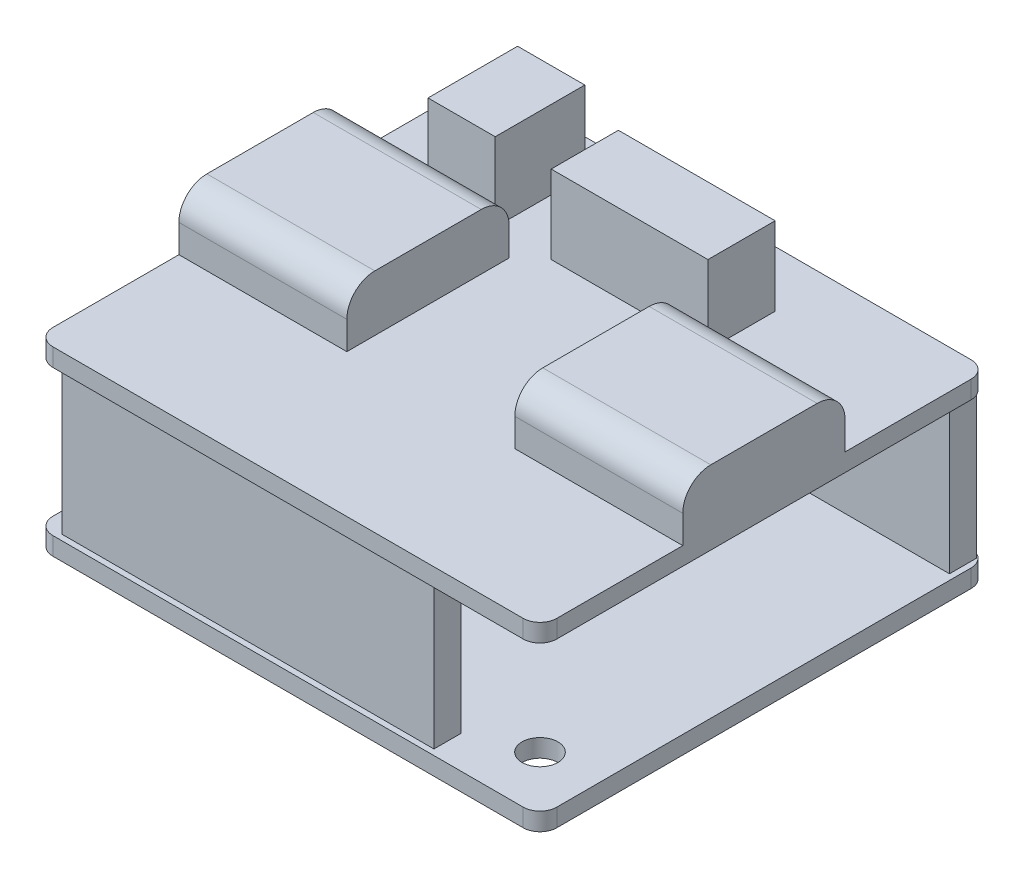
from build123d import *

# Parameters (mm, degrees)
SKETCH1_W            = 45
SKETCH1_H            = 40
BOSS_EXTRUDE1_DEPTH  = 1.6
SKETCH2_W            = 25.91
SKETCH2_H            = 2.41
SKETCH2_W_2          = 33.2
BOSS_EXTRUDE2_DEPTH  = 13
SKETCH3_W            = 45
SKETCH3_H            = 40
BOSS_EXTRUDE3_DEPTH  = 1.6
SKETCH5_W            = 15
SKETCH5_H            = 14.5
BOSS_EXTRUDE5_DEPTH  = 5
FILLET1_R            = 2.5
FILLET1_OF_MIRROR1_R = 2.5
CUT_EXTRUDE1_REACH   = 37.922
SKETCH7_R            = 1.6
FILLET2_R            = 1.5
FILLET3_R            = 1.5
SKETCH8_W            = 14
SKETCH8_H            = 6
SKETCH8_W_2          = 6
SKETCH8_H_2          = 8
BOSS_EXTRUDE6_DEPTH  = 7


with BuildPart() as part:
    # Sketch1 → Boss-Extrude1 (new body)
    with BuildSketch(Plane(origin=(0, 0, 0), x_dir=(1, 0, 0), z_dir=(0, 1, 0))):
        Rectangle(SKETCH1_W, SKETCH1_H)
    extrude(amount=BOSS_EXTRUDE1_DEPTH)

    # Sketch2 → Boss-Extrude2 (add)
    with BuildSketch(Plane(origin=(0, 1.6, 0), x_dir=(1, 0, 0), z_dir=(0, 1, 0))):
        with Locations((9.035, 18.285)):
            Rectangle(SKETCH2_W, SKETCH2_H)
        with Locations((-4.08, -18.285)):
            Rectangle(SKETCH2_W_2, SKETCH2_H)
    extrude(amount=BOSS_EXTRUDE2_DEPTH)

    # Sketch3 → Boss-Extrude3 (add)
    with BuildSketch(Plane(origin=(0, 14.6, 0), x_dir=(1, 0, 0), z_dir=(0, 1, 0))):
        Rectangle(SKETCH3_W, SKETCH3_H)
    extrude(amount=BOSS_EXTRUDE3_DEPTH)

    # Sketch5 → Boss-Extrude5 (add)
    with BuildSketch(Plane(origin=(0, 16.2, 0), x_dir=(1, 0, 0), z_dir=(0, 1, 0))):
        with Locations((-15, 0)):
            Rectangle(SKETCH5_W, SKETCH5_H)
    boss_extrude5 = extrude(amount=BOSS_EXTRUDE5_DEPTH)

    # Fillet1
    fillet1_edges = [part.edges().sort_by_distance(p)[0] for p in [
        (-15, 21.2, -7.25),
        (-15, 21.2, 7.25),
    ]]
    fillet(fillet1_edges, radius=FILLET1_R)

    # Mirror1: Boss-Extrude5 across plane
    add(boss_extrude5.mirror(Plane(origin=(0, 0, 0), x_dir=(0, 0, 1), z_dir=(1, 0, 0))))

    # Fillet1 of Mirror1
    fillet1_of_mirror1_edges = [part.edges().sort_by_distance(p)[0] for p in [
        (15, 21.2, -7.25),
        (15, 21.2, 7.25),
    ]]
    fillet(fillet1_of_mirror1_edges, radius=FILLET1_OF_MIRROR1_R)

    # Sketch7 → Cut-Extrude1 (cut, up to next)
    with BuildSketch(Plane(origin=(0, 1.6, 0), x_dir=(1, 0, 0), z_dir=(0, 1, 0)), mode=Mode.PRIVATE) as cut_extrude1_sk1:
        with Locations((17.5, -15)):
            Circle(SKETCH7_R)
    cut_extrude1_tool1 = extrude(cut_extrude1_sk1.sketch, amount=-CUT_EXTRUDE1_REACH, mode=Mode.PRIVATE) & part.part
    # Sketch7 → Cut-Extrude1 (cut, up to next)
    with BuildSketch(Plane(origin=(0, 1.6, 0), x_dir=(1, 0, 0), z_dir=(0, 1, 0)), mode=Mode.PRIVATE) as cut_extrude1_sk2:
        with Locations((-17.5, 15)):
            Circle(SKETCH7_R)
    cut_extrude1_tool2 = extrude(cut_extrude1_sk2.sketch, amount=-CUT_EXTRUDE1_REACH, mode=Mode.PRIVATE) & part.part
    add(cut_extrude1_tool1.solids().sort_by_distance((17.5, 1.6, 15))[0], mode=Mode.SUBTRACT)
    add(cut_extrude1_tool2.solids().sort_by_distance((-17.5, 1.6, -15))[0], mode=Mode.SUBTRACT)

    # Fillet2
    fillet2_edges = [part.edges().sort_by_distance(p)[0] for p in [
        (-22.5, 0.8, -20),
        (-22.5, 0.8, 20),
        (22.5, 0.8, 20),
        (22.5, 0.8, -20),
    ]]
    fillet(fillet2_edges, radius=FILLET2_R)

    # Fillet3
    fillet3_edges = [part.edges().sort_by_distance(p)[0] for p in [
        (-22.5, 15.4, -20),
        (22.5, 15.4, 20),
        (22.5, 15.4, -20),
        (-22.5, 15.4, 20),
    ]]
    fillet(fillet3_edges, radius=FILLET3_R)

    # Sketch8 → Boss-Extrude6 (add)
    with BuildSketch(Plane(origin=(0, 16.2, 0), x_dir=(1, 0, 0), z_dir=(0, 1, 0))):
        with Locations((1.5, 12)):
            Rectangle(SKETCH8_W, SKETCH8_H)
        with Locations((-13.5, 13)):
            Rectangle(SKETCH8_W_2, SKETCH8_H_2)
    extrude(amount=BOSS_EXTRUDE6_DEPTH)


solid = part.part
